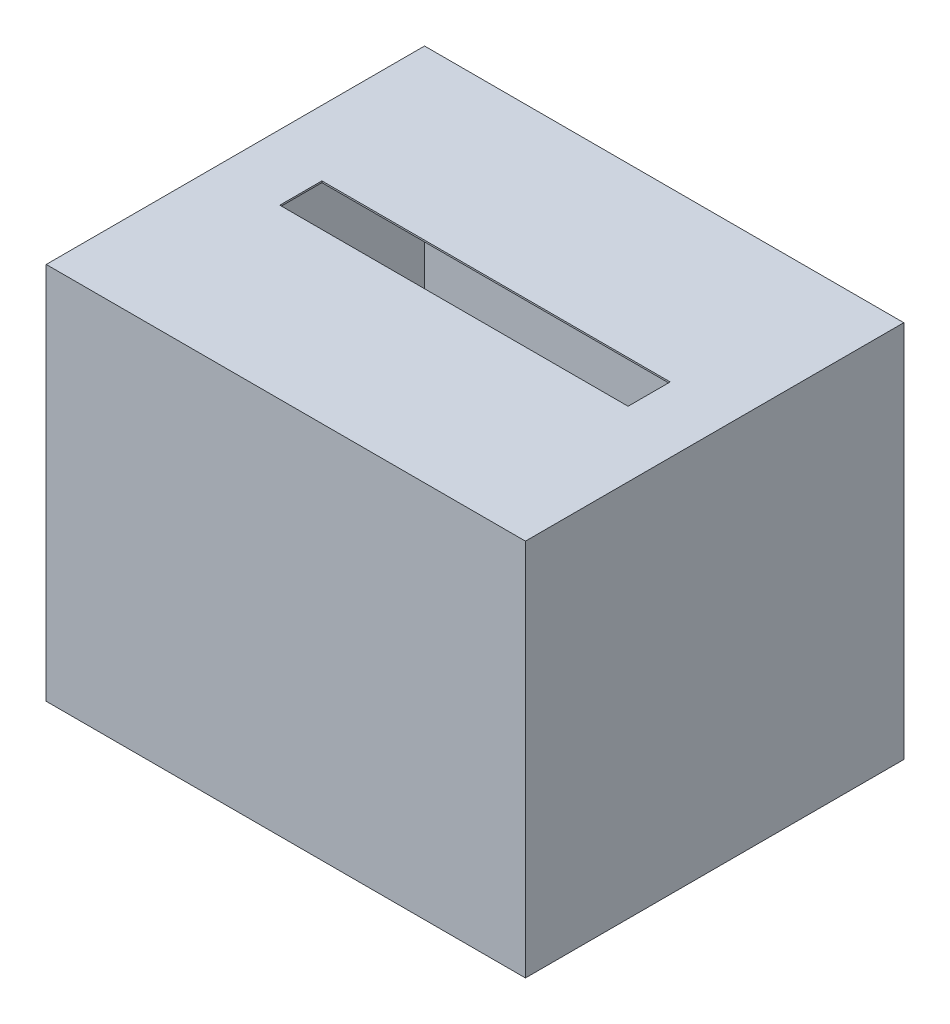
from build123d import *

# Parameters (mm, degrees)
EXTRUDE1_START     = -381
EXTRUDE1_OUTLINE_W = 965.2
EXTRUDE1_OUTLINE_H = 762
EXTRUDE1_DEPTH     = 762
SHELL1_T           = -2.54
SKETCH3_W          = 965.2
SKETCH3_H          = 762
SKETCH3_W_2        = 701.471738738
SKETCH3_H_2        = 84.826616214
EXTRUDE2_DEPTH     = 3.175


# Read off the part's stored shape, not the designer's step: Extrude1
with BuildPart() as part:
    # Extrude1 outline → Extrude1 (new body)
    with BuildSketch(Plane.XY.offset(EXTRUDE1_START)):
        with Locations((482.6, 381)):
            Rectangle(EXTRUDE1_OUTLINE_W, EXTRUDE1_OUTLINE_H)
    extrude(amount=EXTRUDE1_DEPTH)

    # Shell1
    shell1_openings = [part.faces().sort_by_distance(p)[0] for p in [
        (482.6, 762, 0),
    ]]
    offset(amount=SHELL1_T, openings=shell1_openings, kind=Kind.INTERSECTION)

    # Sketch3 → Extrude2 (add)
    with BuildSketch(Plane(origin=(0, 762, 0), x_dir=(-1, 0, 0), z_dir=(0, 1, 0))):
        with Locations((-482.6, 0)):
            Rectangle(SKETCH3_W, SKETCH3_H)
        with Locations((-482.6, 0)):
            Rectangle(SKETCH3_W_2, SKETCH3_H_2, mode=Mode.SUBTRACT)
    extrude(amount=-EXTRUDE2_DEPTH)


solid = part.part
